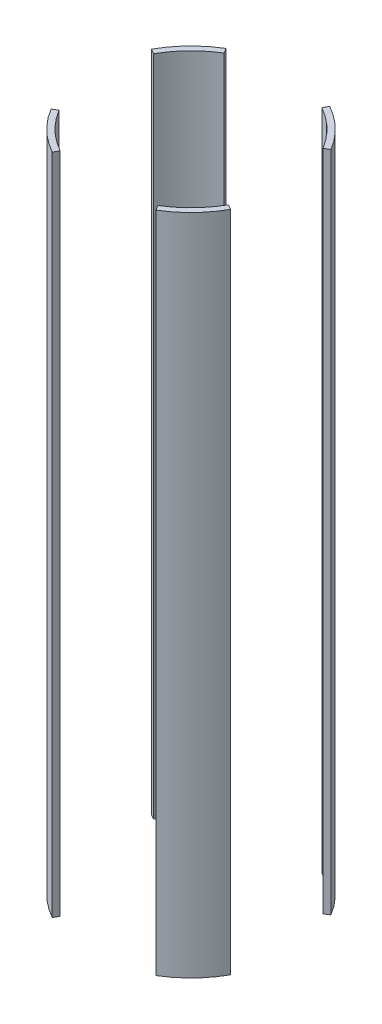
from build123d import *

# Parameters (mm, degrees)
SKETCH2_R               = 88.9
SKETCH2_R_2             = 83.82
BOSS_EXTRUDE1_DEPTH     = 288.798
CUT_EXTRUDE1_DEPTH      = 315.977308395
CUT_EXTRUDE1_DEPTH_BACK = 315.977308395


with BuildPart() as part:
    # Sketch2 → Boss-Extrude1 (new, symmetric)
    with BuildSketch(Plane(origin=(0, 0, 0), x_dir=(1, 0, 0), z_dir=(0, 1, 0))):
        Circle(SKETCH2_R)
        Circle(SKETCH2_R_2, mode=Mode.SUBTRACT)
    extrude(amount=BOSS_EXTRUDE1_DEPTH, both=True)

    # Sketch3 → Cut-Extrude1 (cut, two sides: drawn at the far end of the back side and taken through both)
    with BuildSketch(Plane(origin=(0, 0, 0), x_dir=(1, 0, 0), z_dir=(0, 1, 0)).offset(-CUT_EXTRUDE1_DEPTH_BACK)):
        Polygon((-58.116685864, 96.974944394), (0, 0), (53.900027233, 96.974944394), align=None)
        Polygon((70.991745134, -118.45858783), (0, 0), (-65.840936026, -118.45858783), align=None)
        Polygon((169.661755759, 101.677593364), (0, 0), (169.661755759, -94.300371224), align=None)
        Polygon((-123.741299607, -74.157652604), (0, 0), (-123.741299607, 68.777140945), align=None)
    extrude(amount=CUT_EXTRUDE1_DEPTH + CUT_EXTRUDE1_DEPTH_BACK, mode=Mode.SUBTRACT)


with BuildPart() as cut_extrude1_piece_1:
    # of the separate pieces the step leaves, piece 1, a body of its own (cut_extrude1_pieces)
    add(part.part.solids().sort_by_distance((-45.699187432, -288.798, -76.254798328))[0])


with BuildPart() as cut_extrude1_piece_2:
    # of the separate pieces the step leaves, piece 2, a body of its own (cut_extrude1_pieces)
    add(part.part.solids().sort_by_distance((45.699187432, -288.798, 76.254798328))[0])


with BuildPart() as cut_extrude1_piece_3:
    # of the separate pieces the step leaves, piece 3, a body of its own (cut_extrude1_pieces)
    add(part.part.solids().sort_by_distance((76.254798328, -288.798, -45.699187432))[0])


with BuildPart() as cut_extrude1_piece_4:
    # of the separate pieces the step leaves, piece 4, a body of its own (cut_extrude1_pieces)
    add(part.part.solids().sort_by_distance((-76.254798328, -288.798, 45.699187432))[0])


solid = Compound([cut_extrude1_piece_1.part, cut_extrude1_piece_2.part, cut_extrude1_piece_3.part, cut_extrude1_piece_4.part])
